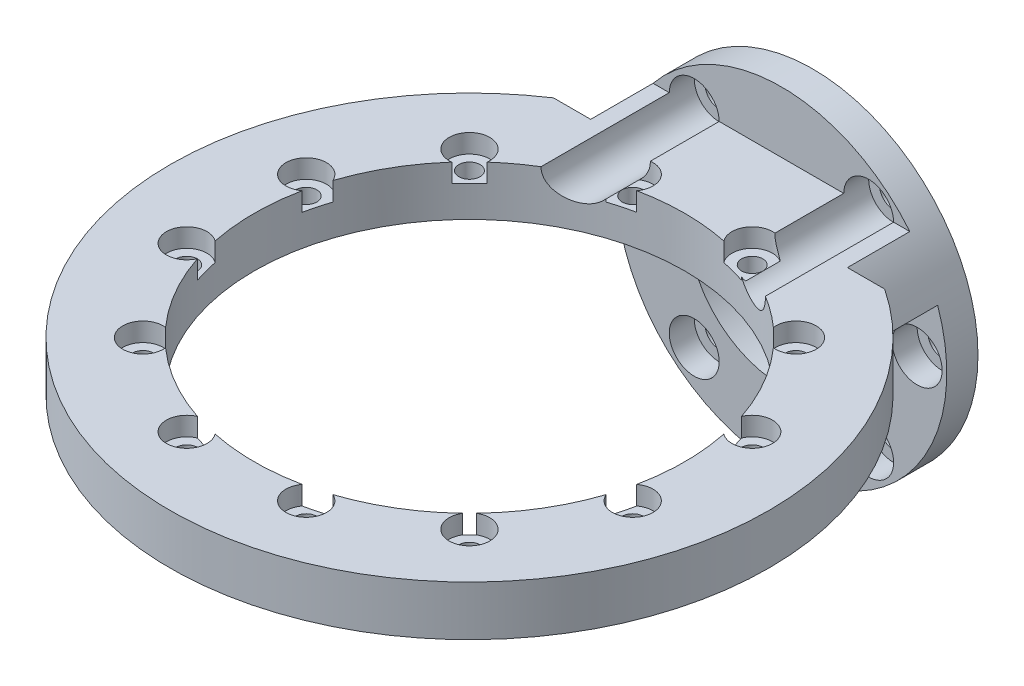
from build123d import *
from build123d.topology import SkipClean

# Parameters (mm, degrees)
SKETCH_1_R                   = 26.5
EXTRUDE_1_DEPTH              = 5
HOLE_WIZARD_M4_1_AT_2_COUNT  = 2
HOLE_WIZARD_M4_1_AT_2_PITCH  = 39.424388736
HOLE_WIZARD_M4_1_AT_3_COUNT  = 2
HOLE_WIZARD_M4_1_AT_3_PITCH  = 39.424388736
HOLE_WIZARD_M4_1_AT_4_COUNT  = 2
HOLE_WIZARD_M4_1_AT_4_PITCH  = 18.383894388
HOLE_WIZARD_M4_1_AT_5_COUNT  = 2
HOLE_WIZARD_M4_1_AT_5_PITCH  = 43.5
HOLE_WIZARD_M4_1_AT_6_COUNT  = 2
HOLE_WIZARD_M4_1_AT_6_PITCH  = 39.424388736
HOLE_WIZARD_M4_1_AT_7_COUNT  = 2
HOLE_WIZARD_M4_1_AT_7_PITCH  = 18.383894388
EXTRUDE_1549_DEPTH           = 8
CUT_EXTRUDE_START            = 22
SKETCH_6_R                   = 4
CUT_EXTRUDE_1659_DEPTH       = 22
SKETCH_8_R                   = 34.5
CUT_EXTRUDE_1745_DEPTH       = 119.962346984
HOLE_WIZARD_M3_1_D           = 3.4
HOLE_WIZARD_M3_1_CBORE_D     = 6.5
HOLE_WIZARD_M3_1_CBORE_DEPTH = 3
CUT_EXTRUDE_1_DEPTH          = 15
CUT_EXTRUDE_2_DEPTH          = 5
CUT_EXTRUDE_3_DEPTH          = 10


with BuildPart() as part:
    # 草图1 → 凸台-拉伸1 (new body)
    with BuildSketch(Plane.XY):
        Circle(SKETCH_1_R)
    extrude(amount=EXTRUDE_1_DEPTH)

    # 草图3 → M4 六角凹头盖的柱孔1 (revolve, cut)
    with BuildSketch(Plane(origin=(21.75, 0, 5), x_dir=(0, -1, 0), z_dir=(1, 0, 0))):
        Polygon((0, 0), (0, 5), (2.25, 5), (2.25, 4), (4, 4), (4, 0), align=None)
    hole_wizard_m4_1 = revolve(axis=Axis((21.75, 0, 11.35), (0, 0, -1)), mode=Mode.SUBTRACT)

    # M4 六角凹头盖的柱孔1 at 2: M4 六角凹头盖的柱孔1 ×2
    with Locations(*[Vector(-0.9063077870366496, 0.4226182617407002, 0) * (i * HOLE_WIZARD_M4_1_AT_2_PITCH) for i in range(1, HOLE_WIZARD_M4_1_AT_2_COUNT)]):
        add(hole_wizard_m4_1, mode=Mode.SUBTRACT)

    # M4 六角凹头盖的柱孔1 at 3: M4 六角凹头盖的柱孔1 ×2
    with Locations(*[Vector(-0.9063077870125524, 0.42261826179237694, 0) * (i * HOLE_WIZARD_M4_1_AT_3_PITCH) for i in range(1, HOLE_WIZARD_M4_1_AT_3_COUNT)]):
        add(hole_wizard_m4_1, mode=Mode.SUBTRACT)

    # M4 六角凹头盖的柱孔1 at 4: M4 六角凹头盖的柱孔1 ×2
    with Locations(*[Vector(-0.42261826172613215, 0.9063077870434428, 0) * (i * HOLE_WIZARD_M4_1_AT_4_PITCH) for i in range(1, HOLE_WIZARD_M4_1_AT_4_COUNT)]):
        add(hole_wizard_m4_1, mode=Mode.SUBTRACT)

    # M4 六角凹头盖的柱孔1 at 5: M4 六角凹头盖的柱孔1 ×2
    with Locations(*[(-i * HOLE_WIZARD_M4_1_AT_5_PITCH, 0, 0) for i in range(1, HOLE_WIZARD_M4_1_AT_5_COUNT)]):
        add(hole_wizard_m4_1, mode=Mode.SUBTRACT)

    # M4 六角凹头盖的柱孔1 at 6: M4 六角凹头盖的柱孔1 ×2
    with Locations(*[Vector(-0.9063077870125524, -0.42261826179237694, 0) * (i * HOLE_WIZARD_M4_1_AT_6_PITCH) for i in range(1, HOLE_WIZARD_M4_1_AT_6_COUNT)]):
        add(hole_wizard_m4_1, mode=Mode.SUBTRACT)

    # M4 六角凹头盖的柱孔1 at 7: M4 六角凹头盖的柱孔1 ×2
    with Locations(*[Vector(-0.42261826172613215, -0.9063077870434428, 0) * (i * HOLE_WIZARD_M4_1_AT_7_PITCH) for i in range(1, HOLE_WIZARD_M4_1_AT_7_COUNT)]):
        add(hole_wizard_m4_1, mode=Mode.SUBTRACT)

    # 草图5 → Extrude 1549 (add)
    with BuildSketch(Plane.XZ.offset(-8.7)):
        with BuildLine():
            Line((-26.5, 5), (-26.5, 14.978130978))
            ThreePointArc((-26.5, 14.978130978), (0, 103), (26.5, 14.978130978))
            Line((26.5, 14.978130978), (26.5, 5))
            Line((26.5, 5), (-26.5, 5))
        make_face()
    extrude(amount=-EXTRUDE_1549_DEPTH)

    # 草图6 → Cut-Extrude 1659 (cut)
    with SkipClean():  # the faces are left unmerged after this step: merging them gives an invalid solid
        with BuildSketch(Plane.XY.offset(5).offset(CUT_EXTRUDE_START)):
            with Locations((-13.98063051, 16.66146664)):
                Circle(SKETCH_6_R)
            with Locations((13.98063051, 16.66146664)):
                Circle(SKETCH_6_R)
        extrude(amount=-CUT_EXTRUDE_1659_DEPTH, mode=Mode.SUBTRACT)
    add(part.part.scale(1), mode=Mode.REPLACE)  # the faces are merged on a copy

    # 草图8 → Cut-Extrude 1745 (cut, through all)
    with BuildSketch(Plane.XZ.offset(-8.7)):
        with Locations((0, 55)):
            Circle(SKETCH_8_R)
    extrude(amount=-CUT_EXTRUDE_1745_DEPTH, mode=Mode.SUBTRACT)

    # M3 六角凹头盖的柱孔1 (through all)
    with Locations(Plane(origin=(-9.576304669, 16.7, 19.260744427), x_dir=(0, 0, 1), z_dir=(0, 1, 0))):
        with Locations((0, 0), (0, 19.152609338), (9.576304669, 35.739255573), (26.162950904, 45.315560242), (45.315560242, 45.315560242), (62.358629164, 36.19567826), (71.478511143, 19.152609339), (71.478511146, 0), (61.902206477, -16.586646235), (9.576304669, -16.586646235), (26.162950904, -26.162950904), (45.315560242, -26.162950904)):
            CounterBoreHole(HOLE_WIZARD_M3_1_D / 2, HOLE_WIZARD_M3_1_CBORE_D / 2, HOLE_WIZARD_M3_1_CBORE_DEPTH)

    # 草图11 → 切除-拉伸1 (cut)
    with BuildSketch(Plane.XY):
        with BuildLine():
            Line((-25.031180555, 8.7), (-29.031180555, 8.7))
            Line((-29.031180555, 8.7), (-29.031180555, 16.7))
            Line((-29.031180555, 16.7), (-20.575713839, 16.7))
            ThreePointArc((-20.575713839, 16.7), (-23.151613423, 12.893905379), (-25.031180555, 8.7))
        make_face()
        with BuildLine():
            Line((29.031180555, 16.7), (20.575713839, 16.7))
            ThreePointArc((20.575713839, 16.7), (23.151613423, 12.893905379), (25.031180555, 8.7))
            Line((25.031180555, 8.7), (29.031180555, 8.7))
            Line((29.031180555, 8.7), (29.031180555, 16.7))
        make_face()
    extrude(amount=CUT_EXTRUDE_1_DEPTH, mode=Mode.SUBTRACT)

    # 草图12 → 切除-拉伸2 (cut)
    with BuildSketch(Plane.XZ.offset(-8.7)):
        with BuildLine():
            Line((30.640436297, 73.992699353), (39.299497484, 79.033088453))
            ThreePointArc((39.299497484, 79.033088453), (22.961941343, 94.93481054), (1, 101.054748323))
            Line((1, 101.054748323), (1, 90.986108088))
            ThreePointArc((1, 90.986108088), (3.29678588, 90.848726312), (5.580104544, 90.56490417))
            ThreePointArc((5.580104544, 90.56490417), (10.611585442, 94.602959438), (12.949935188, 88.59015553))
            ThreePointArc((12.949935188, 88.59015553), (18.110429302, 86.112886725), (22.813026139, 82.848971404))
            ThreePointArc((22.813026139, 82.848971404), (29.429042421, 84.466469087), (27.899229179, 77.829629354))
            ThreePointArc((27.899229179, 77.829629354), (29.332637394, 75.956033707), (30.640436297, 73.992699353))
        make_face()
        with BuildLine():
            Line((31.628764833, 37.893824648), (40.299497484, 32.887774818))
            ThreePointArc((40.299497484, 32.887774818), (45.9673073, 55.081606369), (40.220731453, 77.255173811))
            Line((40.220731453, 77.255173811), (31.60381627, 72.239317654))
            ThreePointArc((31.60381627, 72.239317654), (32.667369713, 70.12740004), (33.58998558, 67.95021794))
            ThreePointArc((33.58998558, 67.95021794), (39.603491283, 65.610874453), (35.563251124, 60.5798469))
            ThreePointArc((35.563251124, 60.5798469), (35.998326415, 55.004146142), (35.564535509, 49.428345312))
            ThreePointArc((35.564535509, 49.428345312), (39.60579141, 44.366506044), (33.551263667, 42.065058704))
            ThreePointArc((33.551263667, 42.065058704), (32.656681203, 39.948715244), (31.628764833, 37.893824648))
        make_face()
        with BuildLine():
            Line((19.898823765, 25.001394455), (25.409425198, 16.693850218))
            ThreePointArc((25.409425198, 16.693850218), (33.152641178, 23.15816615), (39.299497484, 31.15572401))
            Line((39.299497484, 31.15572401), (30.628764833, 36.161773841))
            ThreePointArc((30.628764833, 36.161773841), (29.36313556, 34.244126853), (27.977619592, 32.411223983))
            ThreePointArc((27.977619592, 32.411223983), (29.011771602, 26.01712548), (22.607462255, 26.98603612))
            ThreePointArc((22.607462255, 26.98603612), (21.276296399, 25.962115548), (19.898823765, 25.001394455))
        make_face()
        with BuildLine():
            Line((-1, 90.986108088), (-1, 101.054748323))
            ThreePointArc((-1, 101.054748323), (-22.961941343, 94.93481054), (-39.299497484, 79.033088453))
            Line((-39.299497484, 79.033088453), (-30.640436297, 73.992699353))
            ThreePointArc((-30.640436297, 73.992699353), (-29.332637394, 75.956033707), (-27.899229179, 77.829629354))
            ThreePointArc((-27.899229179, 77.829629354), (-29.429042421, 84.466469087), (-22.813026139, 82.848971404))
            ThreePointArc((-22.813026139, 82.848971404), (-18.110429302, 86.112886725), (-12.949935188, 88.59015553))
            ThreePointArc((-12.949935188, 88.59015553), (-10.611585442, 94.602959438), (-5.580104544, 90.56490417))
            ThreePointArc((-5.580104544, 90.56490417), (-3.29678588, 90.848726312), (-1, 90.986108088))
        make_face()
        with BuildLine():
            ThreePointArc((-33.58998558, 67.95021794), (-32.667369713, 70.12740004), (-31.60381627, 72.239317654))
            Line((-31.60381627, 72.239317654), (-40.220731453, 77.255173811))
            ThreePointArc((-40.220731453, 77.255173811), (-45.9673073, 55.081606369), (-40.299497484, 32.887774818))
            Line((-40.299497484, 32.887774818), (-31.628764833, 37.893824648))
            ThreePointArc((-31.628764833, 37.893824648), (-32.656681203, 39.948715244), (-33.551263667, 42.065058704))
            ThreePointArc((-33.551263667, 42.065058704), (-39.60579141, 44.366506044), (-35.564535509, 49.428345312))
            ThreePointArc((-35.564535509, 49.428345312), (-35.998326415, 55.004146142), (-35.563251124, 60.5798469))
            ThreePointArc((-35.563251124, 60.5798469), (-39.603491283, 65.610874453), (-33.58998558, 67.95021794))
        make_face()
        with BuildLine():
            Line((-30.628764833, 36.161773841), (-39.299497484, 31.15572401))
            ThreePointArc((-39.299497484, 31.15572401), (-33.152641178, 23.15816615), (-25.409425198, 16.693850218))
            Line((-25.409425198, 16.693850218), (-19.898823765, 25.001394455))
            ThreePointArc((-19.898823765, 25.001394455), (-21.276296399, 25.962115548), (-22.607462255, 26.98603612))
            ThreePointArc((-22.607462255, 26.98603612), (-29.011771602, 26.01712548), (-27.977619592, 32.411223983))
            ThreePointArc((-27.977619592, 32.411223983), (-29.36313556, 34.244126853), (-30.628764833, 36.161773841))
        make_face()
    extrude(amount=-CUT_EXTRUDE_2_DEPTH, mode=Mode.SUBTRACT)

    # 草图13 → 切除-拉伸3 (cut)
    with BuildSketch(Plane.XY.offset(5)):
        with BuildLine():
            Line((-12.219247113, 8.7), (12.219247113, 8.7))
            ThreePointArc((12.219247113, 8.7), (0, -15), (-12.219247113, 8.7))
        make_face()
    extrude(amount=-CUT_EXTRUDE_3_DEPTH, mode=Mode.SUBTRACT)


solid = part.part
